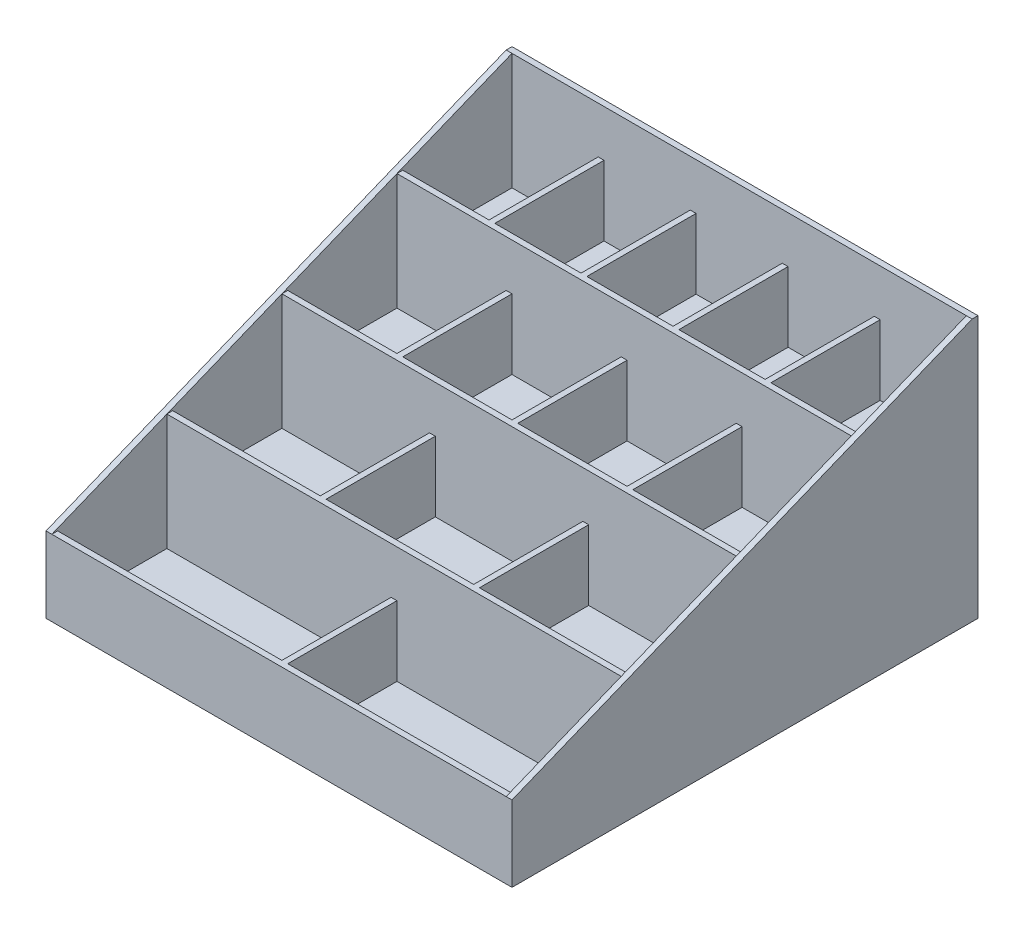
from build123d import *

# Parameters (mm, degrees)
BOSS_EXTRUDE1_DEPTH = 127
SKETCH3_W           = 122.2375
SKETCH3_H           = 59.53125
CUT_EXTRUDE1_DEPTH  = 38.1
SKETCH4_W           = 80.433333333
SKETCH4_H           = 59.53125
SKETCH4_W_2         = 80.433333334
CUT_EXTRUDE2_DEPTH  = 38.1
SKETCH5_W           = 59.53125
SKETCH5_H           = 59.53125
CUT_EXTRUDE3_DEPTH  = 38.1
SKETCH6_W           = 46.99
SKETCH6_H           = 59.53125
CUT_EXTRUDE4_DEPTH  = 38.1
BOSS_EXTRUDE2_DEPTH = 3.175


with BuildPart() as part:
    # Sketch1 → Boss-Extrude1 (new, symmetric)
    with BuildSketch(Plane(origin=(0, 0, 0), x_dir=(0, 0, -1), z_dir=(1, 0, 0))):
        Polygon((0, 0), (254, 0), (254, 117.475), (254, 142.875), (250.825, 142.875), (250.825, 117.475), (188.11875, 117.475), (188.11875, 92.075), (125.4125, 92.075), (125.4125, 66.675), (62.70625, 66.675), (62.70625, 41.275), (0, 41.275), (0, 15.875), align=None)
    extrude(amount=BOSS_EXTRUDE1_DEPTH, both=True)

    # Sketch3 → Cut-Extrude1 (cut)
    with BuildSketch(Plane(origin=(0, 41.275, 0), x_dir=(1, 0, 0), z_dir=(0, 1, 0))):
        with Locations((-62.70625, 32.940625)):
            Rectangle(SKETCH3_W, SKETCH3_H)
        with Locations((62.70625, 32.940625)):
            Rectangle(SKETCH3_W, SKETCH3_H)
    extrude(amount=-CUT_EXTRUDE1_DEPTH, mode=Mode.SUBTRACT)

    # Sketch4 → Cut-Extrude2 (cut)
    with BuildSketch(Plane(origin=(0, 66.675, 0), x_dir=(1, 0, 0), z_dir=(0, 1, 0))):
        with Locations((-83.608333333, 95.646875)):
            Rectangle(SKETCH4_W, SKETCH4_H)
        with Locations((0, 95.646875)):
            Rectangle(SKETCH4_W_2, SKETCH4_H)
        with Locations((83.608333333, 95.646875)):
            Rectangle(SKETCH4_W, SKETCH4_H)
    extrude(amount=-CUT_EXTRUDE2_DEPTH, mode=Mode.SUBTRACT)

    # Sketch5 → Cut-Extrude3 (cut)
    with BuildSketch(Plane(origin=(0, 92.075, 0), x_dir=(1, 0, 0), z_dir=(0, 1, 0))):
        with Locations((-94.059375, 158.353125)):
            Rectangle(SKETCH5_W, SKETCH5_H)
        with Locations((-31.353125, 158.353125)):
            Rectangle(SKETCH5_W, SKETCH5_H)
        with Locations((31.353125, 158.353125)):
            Rectangle(SKETCH5_W, SKETCH5_H)
        with Locations((94.059375, 158.353125)):
            Rectangle(SKETCH5_W, SKETCH5_H)
    extrude(amount=-CUT_EXTRUDE3_DEPTH, mode=Mode.SUBTRACT)

    # Sketch6 → Cut-Extrude4 (cut)
    with BuildSketch(Plane(origin=(0, 117.475, 0), x_dir=(1, 0, 0), z_dir=(0, 1, 0))):
        with Locations((-100.33, 221.059375)):
            Rectangle(SKETCH6_W, SKETCH6_H)
        with Locations((-50.165, 221.059375)):
            Rectangle(SKETCH6_W, SKETCH6_H)
        with Locations((0, 221.059375)):
            Rectangle(SKETCH6_W, SKETCH6_H)
        with Locations((50.165, 221.059375)):
            Rectangle(SKETCH6_W, SKETCH6_H)
        with Locations((100.33, 221.059375)):
            Rectangle(SKETCH6_W, SKETCH6_H)
    extrude(amount=-CUT_EXTRUDE4_DEPTH, mode=Mode.SUBTRACT)

    # Sketch7 → Boss-Extrude2 (add)
    with BuildSketch(Plane(origin=(127, 0, 0), x_dir=(0, 0, -1), z_dir=(1, 0, 0))):
        Polygon((0, 41.275), (250.825, 142.875), (250.825, 41.275), align=None)
    boss_extrude2 = extrude(amount=-BOSS_EXTRUDE2_DEPTH)

    # Mirror1: Boss-Extrude2 across plane
    add(boss_extrude2.mirror(Plane(origin=(0, 0, 0), x_dir=(0, 0, 1), z_dir=(1, 0, 0))))


solid = part.part
